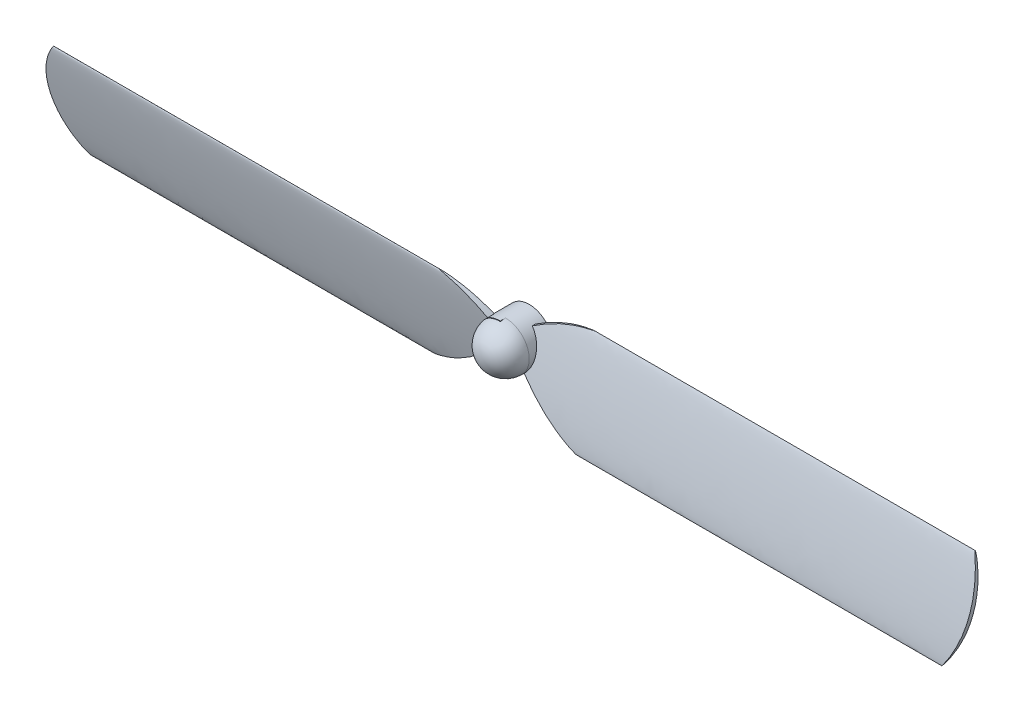
from build123d import *
from build123d.topology import SkipClean

# Parameters (mm, degrees)
ESQUISSE1_R             = 5
BOSS_EXTRU_1_DEPTH      = 10
ESQUISSE2_R             = 2.5
ENL_V_MAT_EXTRU_1_DEPTH = 4
CONG_2_R                = 5
BOSS_EXTRU_2_DEPTH      = 100
BOSS_EXTRU_3_DEPTH      = 100
ENL_V_MAT_EXTRU_4_DEPTH = 100
ENL_V_MAT_EXTRU_5_DEPTH = 100
ENL_V_MAT_EXTRU_6_DEPTH = 100
ENL_V_MAT_EXTRU_7_DEPTH = 100
ESQUISSE10_R            = 2.499999999
ENL_V_MAT_EXTRU_8_DEPTH = 7


with BuildPart() as part:
    # Esquisse1 → Boss.-Extru.1 (new body)
    with BuildSketch(Plane.XY):
        Circle(ESQUISSE1_R)
    extrude(amount=BOSS_EXTRU_1_DEPTH)

    # Esquisse2 → Enlèv. mat.-Extru.1 (cut)
    with BuildSketch(Plane(origin=(0, 0, 0), x_dir=(-1, 0, 0), z_dir=(0, 0, -1))):
        Circle(ESQUISSE2_R)
    extrude(amount=-ENL_V_MAT_EXTRU_1_DEPTH, mode=Mode.SUBTRACT)

    # Congé2
    cong_2_edges = [part.edges().sort_by_distance(p)[0] for p in [
        (-5, 0, 10),
    ]]
    fillet(cong_2_edges, radius=CONG_2_R)

    # Esquisse3 → Boss.-Extru.2 (add)
    with BuildSketch(Plane(origin=(0, 0, 0), x_dir=(0, 0, -1), z_dir=(1, 0, 0))):
        with BuildLine():
            add(Edge.make_bspline(
                [(-1.028441592, 7.744538896), (-0.665839272, 10.444636103), (-5.002175033, -3.759886748), (-7.020948956, -16.905017976), (-1.409968987, 4.903517208), (-1.028441592, 7.744538896)],
                knots=[0, 0, 0, 0, 0.475116603, 0.500085934, 1, 1, 1, 1], degree=3))
        make_face()
    extrude(amount=BOSS_EXTRU_2_DEPTH)

    # Esquisse4 → Boss.-Extru.3 (add)
    with BuildSketch(Plane(origin=(0, 0, 0), x_dir=(0, 0, -1), z_dir=(1, 0, 0))):
        with BuildLine():
            add(Edge.make_bspline(
                [(-6.430114214, 7.863058393), (-6.375904962, 10.940558488), (-1.441784452, -4.324910359), (-1.443440932, -17.748576986), (-6.485547087, 4.716092434), (-6.430114214, 7.863058393)],
                knots=[0, 0, 0, 0, 0.48877691, 0.500190333, 1, 1, 1, 1], degree=3))
        make_face()
    extrude(amount=-BOSS_EXTRU_3_DEPTH)

    # Esquisse6 → Enlèv. mat.-Extru.4 (cut)
    with SkipClean():  # the faces are left unmerged after this step: merging them gives an invalid solid
        with BuildSketch(Plane.XY):
            with BuildLine():
                ThreePointArc((3.139962002, 3.891097354), (0.184601505, 4.996591066), (-2.844276703, 4.112187986))
                add(Edge.make_bspline(
                    [(-2.844276703, 4.112187986), (-8.286830637, 8.129461164), (-14.677422782, 8.493370197)],
                    knots=[0, 0, 0, 1, 1, 1], degree=2))
                Line((-14.677422782, 8.493370197), (17.80867187, 8.275906008))
                add(Edge.make_bspline(
                    [(3.139962002, 3.891097354), (10.045549675, 8.174407239), (17.80867187, 8.275906008)],
                    knots=[0, 0, 0, 1, 1, 1], degree=2))
            make_face()
        extrude(amount=ENL_V_MAT_EXTRU_4_DEPTH, mode=Mode.SUBTRACT)
    add(part.part.scale(1), mode=Mode.REPLACE)  # the faces are merged on a copy

    # Esquisse7 → Enlèv. mat.-Extru.5 (cut)
    with BuildSketch(Plane.XY):
        with BuildLine():
            ThreePointArc((3.502446764, -3.568314261), (-0.398501154, -4.984094384), (-4.024932338, -2.966465856))
            add(Edge.make_bspline(
                [(-4.024932338, -2.966465856), (-13.135971925, -12.406072398), (-24.192336988, -13.209731148)],
                knots=[0, 0, 0, 0.841497317, 0.841497317, 0.841497317], degree=2))
            Line((-24.192336988, -13.209731148), (25.375867371, -13.252358876))
            add(Edge.make_bspline(
                [(3.502446764, -3.568314261), (13.512355587, -12.802396114), (25.375867371, -13.252358876)],
                knots=[0, 0, 0, 0.909001609, 0.909001609, 0.909001609], degree=2))
        make_face()
    extrude(amount=ENL_V_MAT_EXTRU_5_DEPTH, mode=Mode.SUBTRACT)

    # Esquisse8 → Enlèv. mat.-Extru.6 (cut)
    with BuildSketch(Plane.XY):
        with BuildLine():
            Line((-87.521496494, 13.931563231), (-110.029805261, 13.931563231))
            Line((-110.029805261, 13.931563231), (-110.029805261, -20.759670227))
            Line((-110.029805261, -20.759670227), (-87.516677722, -20.759670227))
            Line((-87.516677722, -20.759670227), (-87.516677722, -13.933713224))
            ThreePointArc((-87.516677722, -13.933713224), (-96.559269699, -0.002638325), (-87.521496494, 13.931563231))
        make_face()
    extrude(amount=ENL_V_MAT_EXTRU_6_DEPTH, mode=Mode.SUBTRACT)

    # Esquisse9 → Enlèv. mat.-Extru.7 (cut)
    with BuildSketch(Plane.XY):
        with BuildLine():
            Line((92.353993557, 12.477087418), (114.440173425, 11.015326952))
            Line((114.440173425, 11.015326952), (114.440173425, -13.949103026))
            Line((114.440173425, -13.949103026), (87.942588019, -16.262629006))
            ThreePointArc((87.942588019, -16.262629006), (96.752560189, -2.906493761), (92.353993557, 12.477087418))
        make_face()
    extrude(amount=ENL_V_MAT_EXTRU_7_DEPTH, mode=Mode.SUBTRACT)

    # Esquisse10 → Enlèv. mat.-Extru.8 (cut)
    with BuildSketch(Plane.XY):
        Circle(ESQUISSE10_R)
    extrude(amount=ENL_V_MAT_EXTRU_8_DEPTH, mode=Mode.SUBTRACT)


solid = part.part
